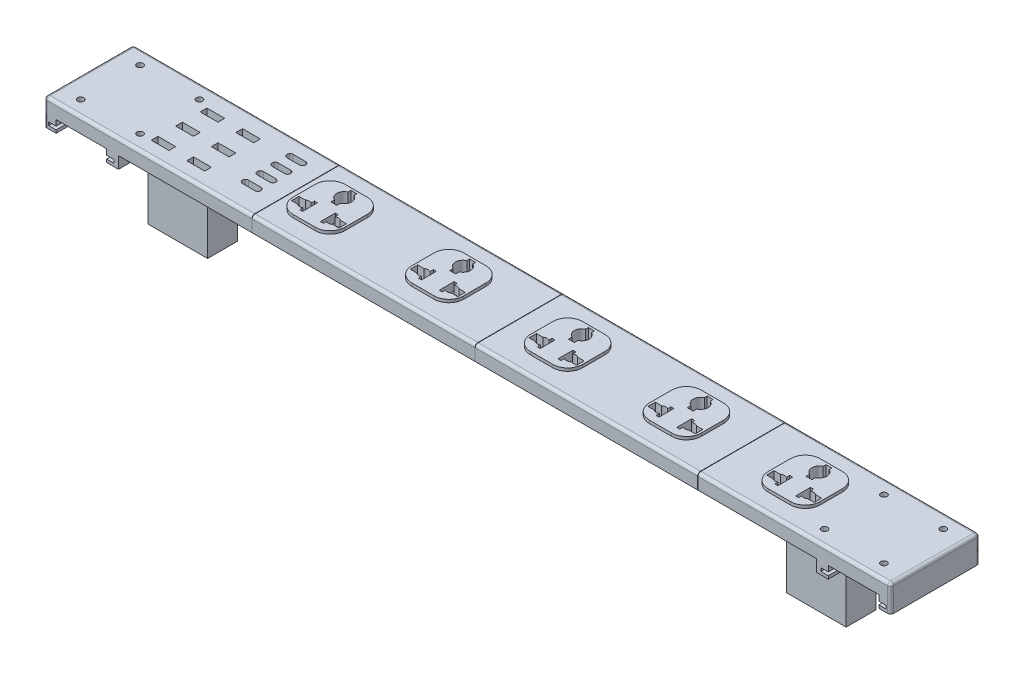
from build123d import *

# Parameters (mm, degrees)
SKETCH1_W                = 470
SKETCH1_H                = 60
BOSS_EXTRUDE1_DEPTH      = 10
SKETCH2_W                = 470
SKETCH2_H                = 20
BOSS_EXTRUDE2_DEPTH      = 50
SKETCH3_W                = 35
SKETCH3_H                = 35
BOSS_EXTRUDE3_DEPTH      = 2
FILLET1_R                = 10
CUT_EXTRUDE1_DEPTH       = 15
LPATTERN1_COUNT          = 5
LPATTERN1_PITCH          = 80
FILLET1_OF_LPATTERN1_R   = 10
SKETCH7_W                = 12
SKETCH7_H                = 4.5
CUT_EXTRUDE2_DEPTH       = 10
BOSS_EXTRUDE4_DEPTH      = 50
SKETCH9_W                = 60
SKETCH9_H                = 10
BOSS_EXTRUDE5_DEPTH      = 50
SKETCH11_W               = 35
SKETCH11_H               = 3
CUT_EXTRUDE3_DEPTH       = 20
SKETCH12_W               = 35
SKETCH12_H               = 3
CUT_EXTRUDE4_DEPTH       = 50
SKETCH13_W               = 35
SKETCH13_H               = 3
CUT_EXTRUDE5_DEPTH       = 50
SKETCH14_W               = 35
SKETCH14_H               = 3
CUT_EXTRUDE6_DEPTH       = 50
SKETCH17_W               = 13
SKETCH17_H               = 5
CUT_EXTRUDE7_DEPTH       = 50
SKETCH20_W               = 37
SKETCH20_H               = 5
CUT_EXTRUDE8_DEPTH       = 50
SKETCH21_W               = 8
SKETCH21_H               = 60
BOSS_EXTRUDE6_DEPTH      = 8
SKETCH22_W               = 2
SKETCH22_H               = 8
BOSS_EXTRUDE7_DEPTH      = 50
SKETCH23_W               = 5
SKETCH23_H               = 2.2
CUT_EXTRUDE9_DEPTH       = 58
SKETCH26_W               = 390
SKETCH26_H               = 50
CUT_EXTRUDE10_DEPTH      = 20
SKETCH27_W               = 10
SKETCH27_H               = 20
BOSS_EXTRUDE8_DEPTH      = 20
FILLET2_R                = 2
FILLET3_R                = 2
FILLET4_R                = 2
SKETCH29_R               = 2.075
CUT_EXTRUDE11_DEPTH      = 10
CROQUIS2_W               = 10
CROQUIS2_H               = 5
SALIENTE_EXTRUIR1_DEPTH  = 80
INDENTACI_N1_START       = -150.24
INDENTACI_N1_OUTLINE_W   = 5.48
INDENTACI_N1_OUTLINE_H   = 10.48
INDENTACI_N1_DEPTH       = 5.24
INDENTACI_N1_START_2     = -145.24
INDENTACI_N1_2_OUTLINE_W = 5.48
INDENTACI_N1_2_OUTLINE_H = 10.48
INDENTACI_N1_2_DEPTH     = 0.24
INDENTACI_N2_START       = 5
INDENTACI_N2_OUTLINE_W   = 5.48
INDENTACI_N2_OUTLINE_H   = 10.48
INDENTACI_N2_DEPTH       = 5.24
INDENTACI_N2_2_OUTLINE_W = 5.48
INDENTACI_N2_2_OUTLINE_H = 10.48
INDENTACI_N2_2_DEPTH     = 0.24
CROQUIS4_W               = 10
CROQUIS4_H               = 5
SALIENTE_EXTRUIR2_DEPTH  = 5
INDENTACI_N3_START       = 155
INDENTACI_N3_OUTLINE_W   = 5.48
INDENTACI_N3_OUTLINE_H   = 10.48
INDENTACI_N3_DEPTH       = 5.24
INDENTACI_N3_2_OUTLINE_W = 5.48
INDENTACI_N3_2_OUTLINE_H = 10.48
INDENTACI_N3_2_DEPTH     = 0.24


# Read off the part's stored shape, not the designer's step: Indentación1, Indentación2, Indentación3
with BuildPart() as part:
    # Sketch1 → Boss-Extrude1 (new body)
    with BuildSketch(Plane(origin=(0, 0, 0), x_dir=(1, 0, 0), z_dir=(0, 1, 0))):
        Rectangle(SKETCH1_W, SKETCH1_H)
    extrude(amount=BOSS_EXTRUDE1_DEPTH)

    # Sketch2 → Boss-Extrude2 (add)
    with BuildSketch(Plane.XZ):
        Rectangle(SKETCH2_W, SKETCH2_H)
    extrude(amount=BOSS_EXTRUDE2_DEPTH)

    # Sketch3 → Boss-Extrude3 (add)
    with BuildSketch(Plane(origin=(0, 10, 0), x_dir=(1, 0, 0), z_dir=(0, 1, 0))):
        with Locations((197.5, 0)):
            Rectangle(SKETCH3_W, SKETCH3_H)
    boss_extrude3 = extrude(amount=BOSS_EXTRUDE3_DEPTH)

    # Fillet1
    fillet1_edges = [part.edges().sort_by_distance(p)[0] for p in [
        (215, 11, 17.5),
        (215, 11, -17.5),
        (180, 11, -17.5),
        (180, 11, 17.5),
    ]]
    fillet(fillet1_edges, radius=FILLET1_R)

    # Sketch5 → Cut-Extrude1 (cut)
    with BuildSketch(Plane(origin=(0, 12, 0), x_dir=(1, 0, 0), z_dir=(0, 1, 0))):
        with BuildLine():
            Line((203.5, -2.5), (205.5, -2.5))
            Line((205.5, -2.5), (205.5, -4.698160912))
            ThreePointArc((205.5, -4.698160912), (207.409467216, -4.26062577), (209.223531105, -5))
            Line((209.223531105, -5), (213.5, -5))
            Line((213.5, -5), (213.5, -10))
            Line((213.5, -10), (209.223531105, -10))
            ThreePointArc((209.223531105, -10), (207.409467216, -10.73937423), (205.5, -10.301839088))
            Line((205.5, -10.301839088), (205.5, -12.5))
            Line((205.5, -12.5), (203.5, -12.5))
            Line((203.5, -12.5), (203.5, -2.5))
        make_face()
        with BuildLine():
            Line((189.5, -2.5), (189.5, -4.698160912))
            ThreePointArc((189.5, -4.698160912), (187.590532784, -4.26062577), (185.776468895, -5))
            Line((185.776468895, -5), (181.5, -5))
            Line((181.5, -5), (181.5, -10))
            Line((181.5, -10), (185.776468895, -10))
            ThreePointArc((185.776468895, -10), (187.590532784, -10.73937423), (189.5, -10.301839088))
            Line((189.5, -10.301839088), (189.5, -12.5))
            Line((189.5, -12.5), (191.5, -12.5))
            Line((191.5, -12.5), (191.5, -2.5))
            Line((191.5, -2.5), (189.5, -2.5))
        make_face()
        with BuildLine():
            Line((195.527489574, 4.905524772), (195.527489574, 2.5))
            Line((195.527489574, 2.5), (199.527489574, 2.5))
            Line((199.527489574, 2.5), (199.527489574, 4.929520153))
            ThreePointArc((199.527489574, 4.929520153), (202.499901679, 9.531356069), (199.470006313, 14.095549491))
            Line((199.470006313, 14.095549491), (199.470006313, 15.999910037))
            Line((199.470006313, 15.999910037), (195.470006313, 15.999910037))
            Line((195.470006313, 15.999910037), (195.470006313, 14.069368187))
            ThreePointArc((195.470006313, 14.069368187), (192.500098368, 9.468636452), (195.527489574, 4.905524772))
        make_face()
    cut_extrude1 = extrude(amount=-CUT_EXTRUDE1_DEPTH, mode=Mode.SUBTRACT)

    # LPattern1: Boss-Extrude3, Cut-Extrude1 ×5
    with Locations(*[(-i * LPATTERN1_PITCH, 0, 0) for i in range(1, LPATTERN1_COUNT)]):
        add(boss_extrude3)
        add(cut_extrude1, mode=Mode.SUBTRACT)

    # Fillet1 of LPattern1
    fillet1_of_lpattern1_edges = [part.edges().sort_by_distance(p)[0] for p in [
        (135, 11, 17.5),
        (135, 11, -17.5),
        (100, 11, -17.5),
        (100, 11, 17.5),
        (55, 11, 17.5),
        (55, 11, -17.5),
        (20, 11, -17.5),
        (20, 11, 17.5),
        (-25, 11, 17.5),
        (-25, 11, -17.5),
        (-60, 11, -17.5),
        (-60, 11, 17.5),
        (-105, 11, 17.5),
        (-105, 11, -17.5),
        (-140, 11, -17.5),
        (-140, 11, 17.5),
    ]]
    fillet(fillet1_of_lpattern1_edges, radius=FILLET1_OF_LPATTERN1_R)

    # Sketch7 → Cut-Extrude2 (cut)
    with BuildSketch(Plane(origin=(0, 10, 0), x_dir=(1, 0, 0), z_dir=(0, 1, 0))):
        with Locations((-217, 15.25)):
            Rectangle(SKETCH7_W, SKETCH7_H)
        with Locations((-217, -1.25)):
            Rectangle(SKETCH7_W, SKETCH7_H)
        with Locations((-217, -17.75)):
            Rectangle(SKETCH7_W, SKETCH7_H)
        with Locations((-193, 15.25)):
            Rectangle(SKETCH7_W, SKETCH7_H)
        with Locations((-193, -1.25)):
            Rectangle(SKETCH7_W, SKETCH7_H)
        with Locations((-193, -17.75)):
            Rectangle(SKETCH7_W, SKETCH7_H)
        with BuildLine():
            Line((-167, 19.537656864), (-158.6, 19.537656864))
            ThreePointArc((-158.6, 19.537656864), (-156.562343136, 17.5), (-158.6, 15.462343136))
            Line((-158.6, 15.462343136), (-167, 15.462343136))
            ThreePointArc((-167, 15.462343136), (-169.037656864, 17.5), (-167, 19.537656864))
        make_face()
        with BuildLine():
            Line((-167, 9.537656864), (-158.6, 9.537656864))
            ThreePointArc((-158.6, 9.537656864), (-156.562343136, 7.5), (-158.6, 5.462343136))
            Line((-158.6, 5.462343136), (-167, 5.462343136))
            ThreePointArc((-167, 5.462343136), (-169.037656864, 7.5), (-167, 9.537656864))
        make_face()
        with BuildLine():
            Line((-167, -0.462343136), (-158.6, -0.462343136))
            ThreePointArc((-158.6, -0.462343136), (-156.562343136, -2.5), (-158.6, -4.537656864))
            Line((-158.6, -4.537656864), (-167, -4.537656864))
            ThreePointArc((-167, -4.537656864), (-169.037656864, -2.5), (-167, -0.462343136))
        make_face()
        with BuildLine():
            Line((-167, -10.462343136), (-158.6, -10.462343136))
            ThreePointArc((-158.6, -10.462343136), (-156.562343136, -12.5), (-158.6, -14.537656864))
            Line((-158.6, -14.537656864), (-167, -14.537656864))
            ThreePointArc((-167, -14.537656864), (-169.037656864, -12.5), (-167, -10.462343136))
        make_face()
    extrude(amount=-CUT_EXTRUDE2_DEPTH, mode=Mode.SUBTRACT)

    # Sketch8 → Boss-Extrude4 (add)
    with BuildSketch(Plane(origin=(235, 0, 0), x_dir=(0, 0, -1), z_dir=(1, 0, 0))):
        Polygon((-30, 10), (-30, 0), (-10, 0), (10, 0), (30, 0), (30, 10), align=None)
    extrude(amount=BOSS_EXTRUDE4_DEPTH)

    # Sketch9 → Boss-Extrude5 (add)
    with BuildSketch(Plane.ZY.offset(235)):
        with Locations((0, 5)):
            Rectangle(SKETCH9_W, SKETCH9_H)
    extrude(amount=BOSS_EXTRUDE5_DEPTH)

    # Sketch11 → Cut-Extrude3 (cut)
    with BuildSketch(Plane(origin=(0, 0, -10), x_dir=(-1, 0, 0), z_dir=(0, 0, -1))):
        with Locations((-197.5, -1.5)):
            Rectangle(SKETCH11_W, SKETCH11_H)
    extrude(amount=-CUT_EXTRUDE3_DEPTH, mode=Mode.SUBTRACT)

    # Sketch12 → Cut-Extrude4 (cut)
    with BuildSketch(Plane(origin=(0, 0, -10), x_dir=(-1, 0, 0), z_dir=(0, 0, -1))):
        with Locations((-117.5, -1.5)):
            Rectangle(SKETCH12_W, SKETCH12_H)
    extrude(amount=-CUT_EXTRUDE4_DEPTH, mode=Mode.SUBTRACT)

    # Sketch13 → Cut-Extrude5 (cut)
    with BuildSketch(Plane(origin=(0, 0, -10), x_dir=(-1, 0, 0), z_dir=(0, 0, -1))):
        with Locations((-37.5, -1.5)):
            Rectangle(SKETCH13_W, SKETCH13_H)
    extrude(amount=-CUT_EXTRUDE5_DEPTH, mode=Mode.SUBTRACT)

    # Sketch14 → Cut-Extrude6 (cut)
    with BuildSketch(Plane(origin=(0, 0, -10), x_dir=(-1, 0, 0), z_dir=(0, 0, -1))):
        with Locations((42.5, -1.5)):
            Rectangle(SKETCH14_W, SKETCH14_H)
        with Locations((122.5, -1.5)):
            Rectangle(SKETCH14_W, SKETCH14_H)
    extrude(amount=-CUT_EXTRUDE6_DEPTH, mode=Mode.SUBTRACT)

    # Sketch17 → Cut-Extrude7 (cut)
    with BuildSketch(Plane(origin=(0, 0, -10), x_dir=(-1, 0, 0), z_dir=(0, 0, -1))):
        with Locations((163, -2.5)):
            Rectangle(SKETCH17_W, SKETCH17_H)
    extrude(amount=-CUT_EXTRUDE7_DEPTH, mode=Mode.SUBTRACT)

    # Sketch20 → Cut-Extrude8 (cut)
    with BuildSketch(Plane(origin=(0, 0, -10), x_dir=(-1, 0, 0), z_dir=(0, 0, -1))):
        with Locations((205, -2.5)):
            Rectangle(SKETCH20_W, SKETCH20_H)
    extrude(amount=-CUT_EXTRUDE8_DEPTH, mode=Mode.SUBTRACT)

    # Sketch21 → Boss-Extrude6 (add)
    with BuildSketch(Plane.XZ):
        with Locations((-281, 0)):
            Rectangle(SKETCH21_W, SKETCH21_H)
        with Locations((-239, 0)):
            Rectangle(SKETCH21_W, SKETCH21_H)
    boss_extrude6 = extrude(amount=BOSS_EXTRUDE6_DEPTH)

    # Sketch22 → Boss-Extrude7 (add)
    with BuildSketch(Plane.ZY.offset(285)):
        with Locations((-29, -4)):
            Rectangle(SKETCH22_W, SKETCH22_H)
    boss_extrude7 = extrude(amount=-BOSS_EXTRUDE7_DEPTH)

    # Sketch23 → Cut-Extrude9 (cut)
    with BuildSketch(Plane.XY.offset(30)):
        with Locations((-279.5, -4.9)):
            Rectangle(SKETCH23_W, SKETCH23_H)
        with Locations((-240.5, -4.9)):
            Rectangle(SKETCH23_W, SKETCH23_H)
    cut_extrude9 = extrude(amount=-CUT_EXTRUDE9_DEPTH, mode=Mode.SUBTRACT)

    # Mirror1: Boss-Extrude6, Boss-Extrude7, Cut-Extrude9 across plane
    add(boss_extrude6.mirror(Plane(origin=(0, 0, 0), x_dir=(0, 0, 1), z_dir=(1, 0, 0))))
    add(boss_extrude7.mirror(Plane(origin=(0, 0, 0), x_dir=(0, 0, 1), z_dir=(1, 0, 0))))
    add(cut_extrude9.mirror(Plane(origin=(0, 0, 0), x_dir=(0, 0, 1), z_dir=(1, 0, 0))), mode=Mode.SUBTRACT)

    # Sketch26 → Cut-Extrude10 (cut)
    with BuildSketch(Plane.XY.offset(10)):
        with Locations((0, -25)):
            Rectangle(SKETCH26_W, SKETCH26_H)
    extrude(amount=-CUT_EXTRUDE10_DEPTH, mode=Mode.SUBTRACT)

    # Sketch27 → Boss-Extrude8 (add)
    with BuildSketch(Plane.XZ):
        with Locations((-205, 0)):
            Rectangle(SKETCH27_W, SKETCH27_H)
    extrude(amount=BOSS_EXTRUDE8_DEPTH)

    # Fillet2
    fillet2_edges = [part.edges().sort_by_distance(p)[0] for p in [
        (0, 10, -30),
        (0, 10, 30),
    ]]
    fillet(fillet2_edges, radius=FILLET2_R)

    # Fillet3
    fillet3_edges = [part.edges().sort_by_distance(p)[0] for p in [
        (-285, 10, 0),
        (-285, 0, -30),
        (-285, 9.414213562, 29.414213562),
        (-285, 9.414213562, -29.414213562),
        (-285, 0, 30),
    ]]
    fillet(fillet3_edges, radius=FILLET3_R)

    # Fillet4
    fillet4_edges = [part.edges().sort_by_distance(p)[0] for p in [
        (285, 10, 0),
        (285, 0, 30),
        (285, 9.414213562, 29.414213562),
        (285, 9.414213562, -29.414213562),
        (285, 0, -30),
    ]]
    fillet(fillet4_edges, radius=FILLET4_R)

    # Sketch29 → Cut-Extrude11 (cut)
    with BuildSketch(Plane(origin=(0, 10, 0), x_dir=(1, 0, 0), z_dir=(0, 1, 0))):
        with Locations(Location((-270.5, 20, 0), (0, 0, 270))):
            Circle(SKETCH29_R)
        with Locations(Location((-230.5, 20, 0), (0, 0, 270))):
            Circle(SKETCH29_R)
        with Locations(Location((-270.5, -20, 0), (0, 0, 270))):
            Circle(SKETCH29_R)
        with Locations(Location((-230.5, -20, 0), (0, 0, 270))):
            Circle(SKETCH29_R)
    cut_extrude11 = extrude(amount=-CUT_EXTRUDE11_DEPTH, mode=Mode.SUBTRACT)

    # Mirror2: Cut-Extrude11 across plane
    add(cut_extrude11.mirror(Plane(origin=(0, 0, 0), x_dir=(0, 0, 1), z_dir=(1, 0, 0))), mode=Mode.SUBTRACT)


with BuildPart() as body_2:
    # Partir1: the piece on the far side of the plane
    add(part.part)
    split(bisect_by=Plane(origin=(-145, 0, 0), x_dir=(0, 0, -1), z_dir=(-1, 0, 0)), keep=Keep.BOTTOM)


with BuildPart() as part_1:
    add(part.part)

    # Partir1
    split(bisect_by=Plane(origin=(-145, 0, 0), x_dir=(0, 0, -1), z_dir=(-1, 0, 0)), keep=Keep.TOP)

    # Indentación1 outline → Indentación1 (cut)
    with BuildSketch(Plane.YZ.offset(INDENTACI_N1_START)):
        with Locations((4, 0)):
            Rectangle(INDENTACI_N1_OUTLINE_W, INDENTACI_N1_OUTLINE_H)
    extrude(amount=INDENTACI_N1_DEPTH, mode=Mode.SUBTRACT)

    # Indentaci_n1 2 outline → Indentaci_n1 2 (cut)
    with BuildSketch(Plane.YZ.offset(INDENTACI_N1_START_2)):
        with BuildLine():
            Line((0, 30), (0, -30))
            Line((0, -30), (8, -30))
            ThreePointArc((8, -30), (9.414213562, -29.414213562), (10, -28))
            Line((10, -28), (10, 28))
            ThreePointArc((10, 28), (9.414213562, 29.414213562), (8, 30))
            Line((8, 30), (0, 30))
        make_face()
        with Locations((4, 0)):
            Rectangle(INDENTACI_N1_2_OUTLINE_W, INDENTACI_N1_2_OUTLINE_H, mode=Mode.SUBTRACT)
    extrude(amount=INDENTACI_N1_2_DEPTH, mode=Mode.SUBTRACT)


with BuildPart() as body_3:
    # Partir2: the piece on the far side of the plane
    add(body_2.part)
    split(bisect_by=Plane(origin=(5, 0, 0), x_dir=(0, 0, -1), z_dir=(-1, 0, 0)), keep=Keep.BOTTOM)


with BuildPart() as body_2_1:
    add(body_2.part)

    # Partir2
    split(bisect_by=Plane(origin=(5, 0, 0), x_dir=(0, 0, -1), z_dir=(-1, 0, 0)), keep=Keep.TOP)

    # Croquis2 → Saliente-Extruir1 (add, symmetric)
    with BuildSketch(Plane.ZY.offset(70)):
        with Locations((0, 4)):
            Rectangle(CROQUIS2_W, CROQUIS2_H)
    extrude(amount=SALIENTE_EXTRUIR1_DEPTH, both=True)


with BuildPart() as body_4:
    # Partir3: the piece on the far side of the plane
    add(body_3.part)
    split(bisect_by=Plane(origin=(155, 0, 0), x_dir=(0, 0, -1), z_dir=(-1, 0, 0)), keep=Keep.BOTTOM)

    # Indentación3 outline → Indentación3 (cut)
    with BuildSketch(Plane.YZ.offset(INDENTACI_N3_START)):
        with Locations((4, 0)):
            Rectangle(INDENTACI_N3_OUTLINE_W, INDENTACI_N3_OUTLINE_H)
    extrude(amount=INDENTACI_N3_DEPTH, mode=Mode.SUBTRACT)

    # Indentaci_n3 2 outline → Indentaci_n3 2 (cut)
    with BuildSketch(Plane.YZ.offset(INDENTACI_N3_START)):
        with BuildLine():
            Line((0, 30), (0, -30))
            Line((0, -30), (8, -30))
            ThreePointArc((8, -30), (9.414213562, -29.414213562), (10, -28))
            Line((10, -28), (10, 28))
            ThreePointArc((10, 28), (9.414213562, 29.414213562), (8, 30))
            Line((8, 30), (0, 30))
        make_face()
        with Locations((4, 0)):
            Rectangle(INDENTACI_N3_2_OUTLINE_W, INDENTACI_N3_2_OUTLINE_H, mode=Mode.SUBTRACT)
    extrude(amount=INDENTACI_N3_2_DEPTH, mode=Mode.SUBTRACT)


with BuildPart() as body_3_1:
    add(body_3.part)

    # Partir3
    split(bisect_by=Plane(origin=(155, 0, 0), x_dir=(0, 0, -1), z_dir=(-1, 0, 0)), keep=Keep.TOP)

    # Indentación2 outline → Indentación2 (cut)
    with BuildSketch(Plane.YZ.offset(INDENTACI_N2_START)):
        with Locations((4, 0)):
            Rectangle(INDENTACI_N2_OUTLINE_W, INDENTACI_N2_OUTLINE_H)
    extrude(amount=INDENTACI_N2_DEPTH, mode=Mode.SUBTRACT)

    # Indentaci_n2 2 outline → Indentaci_n2 2 (cut)
    with BuildSketch(Plane.YZ.offset(INDENTACI_N2_START)):
        with BuildLine():
            Line((8, 30), (0, 30))
            Line((0, 30), (0, -30))
            Line((0, -30), (8, -30))
            ThreePointArc((8, -30), (9.414213562, -29.414213562), (10, -28))
            Line((10, -28), (10, 28))
            ThreePointArc((10, 28), (9.414213562, 29.414213562), (8, 30))
        make_face()
        with Locations((4, 0)):
            Rectangle(INDENTACI_N2_2_OUTLINE_W, INDENTACI_N2_2_OUTLINE_H, mode=Mode.SUBTRACT)
    extrude(amount=INDENTACI_N2_2_DEPTH, mode=Mode.SUBTRACT)

    # Croquis4 → Saliente-Extruir2 (add)
    with BuildSketch(Plane(origin=(155, 0, 0), x_dir=(0, 0, -1), z_dir=(1, 0, 0))):
        with Locations((0, 4)):
            Rectangle(CROQUIS4_W, CROQUIS4_H)
    extrude(amount=SALIENTE_EXTRUIR2_DEPTH)


solid = Compound([part_1.part, body_2_1.part, body_4.part, body_3_1.part])
